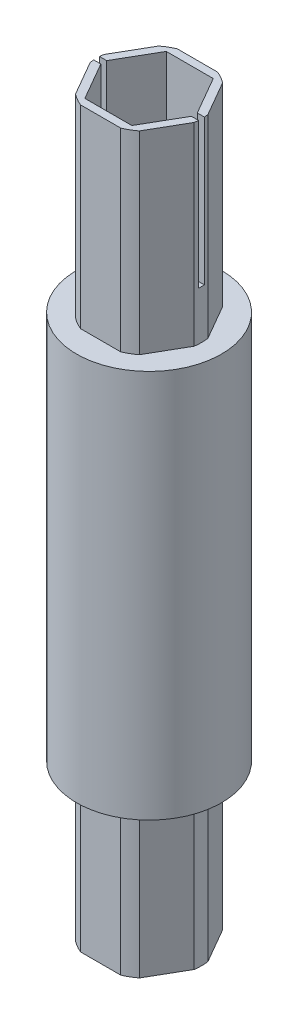
from build123d import *

# Parameters (mm, degrees)
BOSS_EXTRUDE1_DEPTH = 19.812
SKETCH2_R           = 9.5
BOSS_EXTRUDE2_DEPTH = 50.927
BOSS_EXTRUDE6_START = 76.327
BOSS_EXTRUDE6_DEPTH = 76.327
SKETCH6_W           = 13.75
SKETCH6_H           = 0.762
CUT_EXTRUDE1_DEPTH  = 19.05
CUT_EXTRUDE2_DEPTH  = 29.016999878


with BuildPart() as part:
    # Sketch1 → Boss-Extrude1 (new body)
    with BuildSketch(Plane(origin=(0, 0, 0), x_dir=(1, 0, 0), z_dir=(0, 1, 0))):
        with BuildLine():
            Line((6.816751826, 0.893039494), (4.181770802, 5.456960506))
            ThreePointArc((4.181770802, 5.456960506), (3.4375, 5.953924651), (2.634981025, 6.35))
            Line((2.634981025, 6.35), (-2.634981025, 6.35))
            ThreePointArc((-2.634981025, 6.35), (-3.4375, 5.953924651), (-4.181770802, 5.456960506))
            Line((-4.181770802, 5.456960506), (-6.816751826, 0.893039494))
            ThreePointArc((-6.816751826, 0.893039494), (-6.875, 0), (-6.816751826, -0.893039494))
            Line((-6.816751826, -0.893039494), (-4.181770802, -5.456960506))
            ThreePointArc((-4.181770802, -5.456960506), (-3.4375, -5.953924651), (-2.634981025, -6.35))
            Line((-2.634981025, -6.35), (2.634981025, -6.35))
            ThreePointArc((2.634981025, -6.35), (3.4375, -5.953924651), (4.181770802, -5.456960506))
            Line((4.181770802, -5.456960506), (6.816751826, -0.893039494))
            ThreePointArc((6.816751826, -0.893039494), (6.875, 0), (6.816751826, 0.893039494))
        make_face()
    extrude(amount=-BOSS_EXTRUDE1_DEPTH)

    # Sketch2 → Boss-Extrude2 (add)
    with BuildSketch(Plane(origin=(0, 0, 0), x_dir=(-1, 0, 0), z_dir=(0, -1, 0))):
        Circle(SKETCH2_R)
    extrude(amount=-BOSS_EXTRUDE2_DEPTH)

    # Sketch1<4> → Boss-Extrude6 (add)
    with BuildSketch(Plane(origin=(0, 0, 0), x_dir=(1, 0, 0), z_dir=(0, 1, 0)).offset(BOSS_EXTRUDE6_START)):
        with BuildLine():
            Line((6.816751826, 0.893039494), (4.181770802, 5.456960506))
            ThreePointArc((4.181770802, 5.456960506), (3.4375, 5.953924651), (2.634981025, 6.35))
            Line((2.634981025, 6.35), (-2.634981025, 6.35))
            ThreePointArc((-2.634981025, 6.35), (-3.4375, 5.953924651), (-4.181770802, 5.456960506))
            Line((-4.181770802, 5.456960506), (-6.816751826, 0.893039494))
            ThreePointArc((-6.816751826, 0.893039494), (-6.875, 0), (-6.816751826, -0.893039494))
            Line((-6.816751826, -0.893039494), (-4.181770802, -5.456960506))
            ThreePointArc((-4.181770802, -5.456960506), (-3.4375, -5.953924651), (-2.634981025, -6.35))
            Line((-2.634981025, -6.35), (2.634981025, -6.35))
            ThreePointArc((2.634981025, -6.35), (3.4375, -5.953924651), (4.181770802, -5.456960506))
            Line((4.181770802, -5.456960506), (6.816751826, -0.893039494))
            ThreePointArc((6.816751826, -0.893039494), (6.875, 0), (6.816751826, 0.893039494))
        make_face()
    extrude(amount=-BOSS_EXTRUDE6_DEPTH)

    # Sketch6 → Cut-Extrude1 (cut)
    with BuildSketch(Plane(origin=(0, 76.327, 0), x_dir=(1, 0, 0), z_dir=(0, 1, 0))):
        Rectangle(SKETCH6_W, SKETCH6_H)
    extrude(amount=-CUT_EXTRUDE1_DEPTH, mode=Mode.SUBTRACT)

    # Sketch7 → Cut-Extrude2 (cut)
    with BuildSketch(Plane(origin=(0, 76.327, 0), x_dir=(1, 0, 0), z_dir=(0, 1, 0))):
        Polygon((3.079586336, 5.334), (-3.079586336, 5.334), (-6.159172672, 0), (-3.079586336, -5.334), (3.079586336, -5.334), (6.159172672, 0), align=None)
    extrude(amount=-CUT_EXTRUDE2_DEPTH, mode=Mode.SUBTRACT)


solid = part.part
